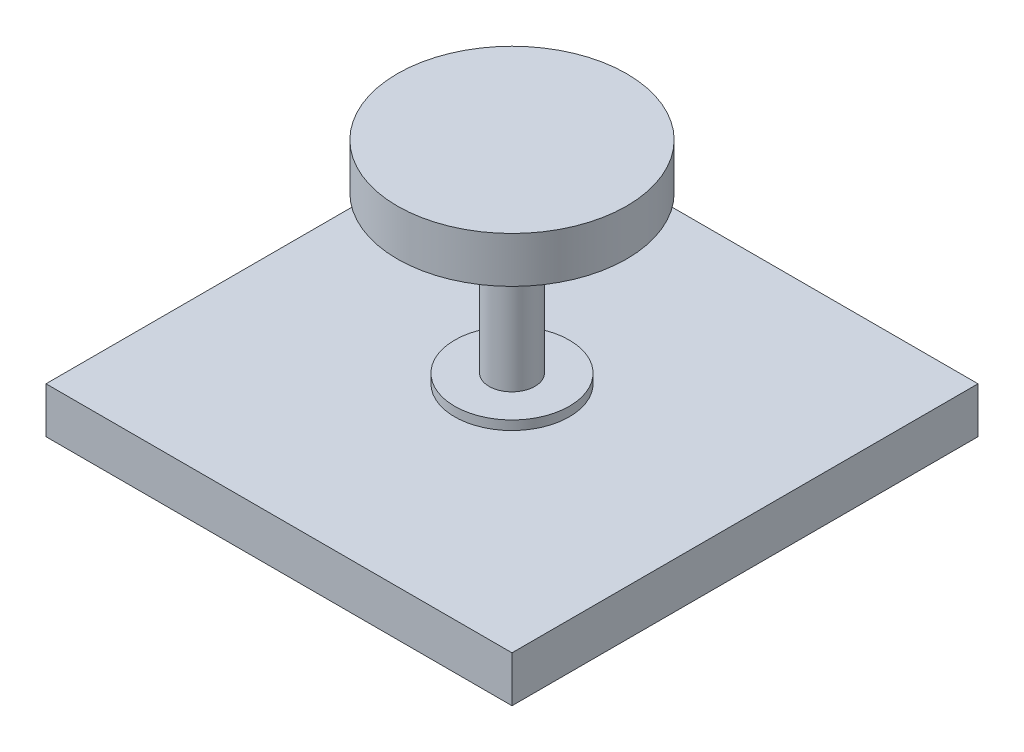
from build123d import *

# Parameters (mm, degrees)
SKETCH1_W           = 101.6
SKETCH1_H           = 101.6
BOSS_EXTRUDE1_DEPTH = 10
SKETCH2_R           = 5
CUT_EXTRUDE1_DEPTH  = 5
SKETCH3_R           = 12.5
BOSS_EXTRUDE2_DEPTH = 2
SKETCH4_R           = 5
BOSS_EXTRUDE3_DEPTH = 34.054688013
SKETCH5_R           = 25
BOSS_EXTRUDE4_DEPTH = 10


with BuildPart() as part:
    # Sketch1 → Boss-Extrude1 (new body)
    with BuildSketch(Plane(origin=(0, 0, 0), x_dir=(1, 0, 0), z_dir=(0, 1, 0))):
        Rectangle(SKETCH1_W, SKETCH1_H)
    extrude(amount=BOSS_EXTRUDE1_DEPTH)

    # Sketch2 → Cut-Extrude1 (cut)
    with BuildSketch(Plane(origin=(0, 0, 0), x_dir=(-1, 0, 0), z_dir=(0, -1, 0))):
        Circle(SKETCH2_R)
    extrude(amount=-CUT_EXTRUDE1_DEPTH, mode=Mode.SUBTRACT)

    # Sketch3 → Boss-Extrude2 (add)
    with BuildSketch(Plane(origin=(0, 10, 0), x_dir=(1, 0, 0), z_dir=(0, 1, 0))):
        Circle(SKETCH3_R)
    extrude(amount=BOSS_EXTRUDE2_DEPTH)

    # Sketch4 → Boss-Extrude3 (add)
    with BuildSketch(Plane(origin=(0, 12, 0), x_dir=(1, 0, 0), z_dir=(0, 1, 0))):
        Circle(SKETCH4_R)
    extrude(amount=BOSS_EXTRUDE3_DEPTH)

    # Sketch5 → Boss-Extrude4 (add)
    with BuildSketch(Plane(origin=(0, 46.054688013, 0), x_dir=(1, 0, 0), z_dir=(0, 1, 0))):
        Circle(SKETCH5_R)
    extrude(amount=BOSS_EXTRUDE4_DEPTH)


solid = part.part
